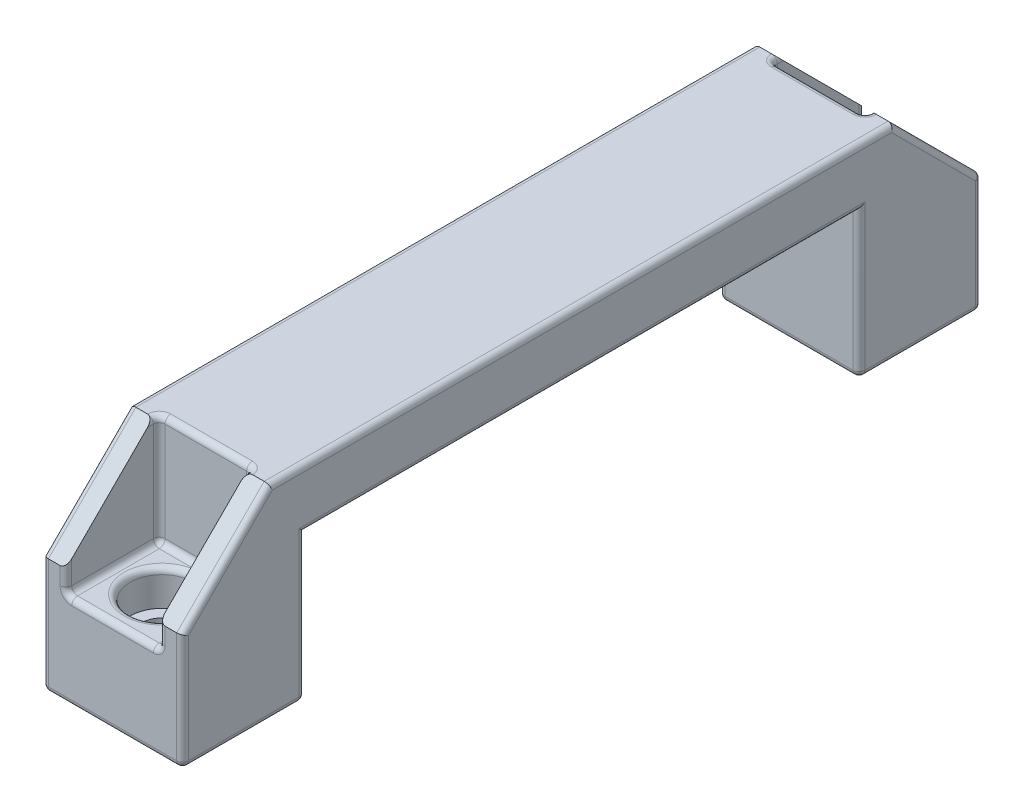
from build123d import *

# Parameters (mm, degrees)
EXTRUDE_1_DEPTH             = 12
SKETCH_2_W                  = 16
SKETCH_2_H                  = 16
CUT_EXTRUDE_1_DEPTH         = 24
HOLE_WIZARD_C_3_D           = 7
HOLE_WIZARD_C_3_CBORE_D     = 11
HOLE_WIZARD_C_3_CBORE_DEPTH = 6
FILLET_1_R                  = 1


with BuildPart() as part:
    # 草图1 → 凸台-拉伸1 (new, symmetric)
    with BuildSketch(Plane(origin=(0, 0, 0), x_dir=(0, 0, -1), z_dir=(1, 0, 0))):
        Polygon((-53.5, 0), (53.5, 0), (68.5, -15), (68.5, -35), (47.5, -35), (47.5, -10), (-47.5, -10), (-47.5, -35), (-68.5, -35), (-68.5, -15), align=None)
    extrude(amount=EXTRUDE_1_DEPTH, both=True)

    # 草图2 → 切除-拉伸1 (cut)
    with BuildSketch(Plane(origin=(0, -19, 0), x_dir=(-1, 0, 0), z_dir=(0, -1, 0))):
        with Locations((0, -60.5)):
            Rectangle(SKETCH_2_W, SKETCH_2_H)
        with Locations((0, 60.5)):
            Rectangle(SKETCH_2_W, SKETCH_2_H)
    extrude(amount=-CUT_EXTRUDE_1_DEPTH, mode=Mode.SUBTRACT)

    # 打孔尺寸根据六角头螺栓 C 级的类型3 (through all)
    with Locations(Plane(origin=(0, -19, 0), x_dir=(1, 0, 0), z_dir=(0, 1, 0))):
        with Locations((0, -60), (0, 60)):
            CounterBoreHole(HOLE_WIZARD_C_3_D / 2, HOLE_WIZARD_C_3_CBORE_D / 2, HOLE_WIZARD_C_3_CBORE_DEPTH)

    # 圆角1
    fillet_1_edges = [part.edges().sort_by_distance(p)[0] for p in [
        (12, -7.5, 61),
        (-12, -22.5, -47.5),
        (-12, -10, 0),
        (-12, -22.5, 47.5),
        (-12, -35, 58),
        (-12, -25, 68.5),
        (-12, -7.5, 61),
        (-12, 0, 0),
        (-12, -7.5, -61),
        (12, -25, 68.5),
        (12, -35, 58),
        (10, -15, -68.5),
        (0, -35, -68.5),
        (0, -35, -47.5),
        (0, -35, 47.5),
        (0, -35, 68.5),
        (12, -22.5, 47.5),
        (12, -10, 0),
        (12, -22.5, -47.5),
        (12, -35, -58),
        (8, -17, 68.5),
        (-8, -17, 68.5),
        (12, -25, -68.5),
        (0, 0, 52.5),
        (8, -9.5, 52.5),
        (-8, 0, 53),
        (-8, -9.5, 52.5),
        (8, 0, 53),
        (-8, -19, 60.5),
        (0, -19, 52.5),
        (8, -19, 60.5),
        (0, -19, 68.5),
        (12, -7.5, -61),
        (-10, -15, -68.5),
        (8, -17, -68.5),
        (-8, -17, -68.5),
        (0, 0, -52.5),
        (-8, -9.5, -52.5),
        (-8, 0, -53),
        (8, 0, -53),
        (8, -9.5, -52.5),
        (0, -19, -68.5),
        (8, -19, -60.5),
        (0, -19, -52.5),
        (-8, -19, -60.5),
        (-5.5, -19, -60),
        (3.5, -35, -60),
        (12, 0, 0),
        (-5.5, -19, 60),
        (3.5, -35, 60),
        (-12, -25, -68.5),
        (-12, -35, -58),
    ]]
    fillet(fillet_1_edges, radius=FILLET_1_R - 0.0001)  # a hair under: the kernel refuses the full size


solid = part.part
